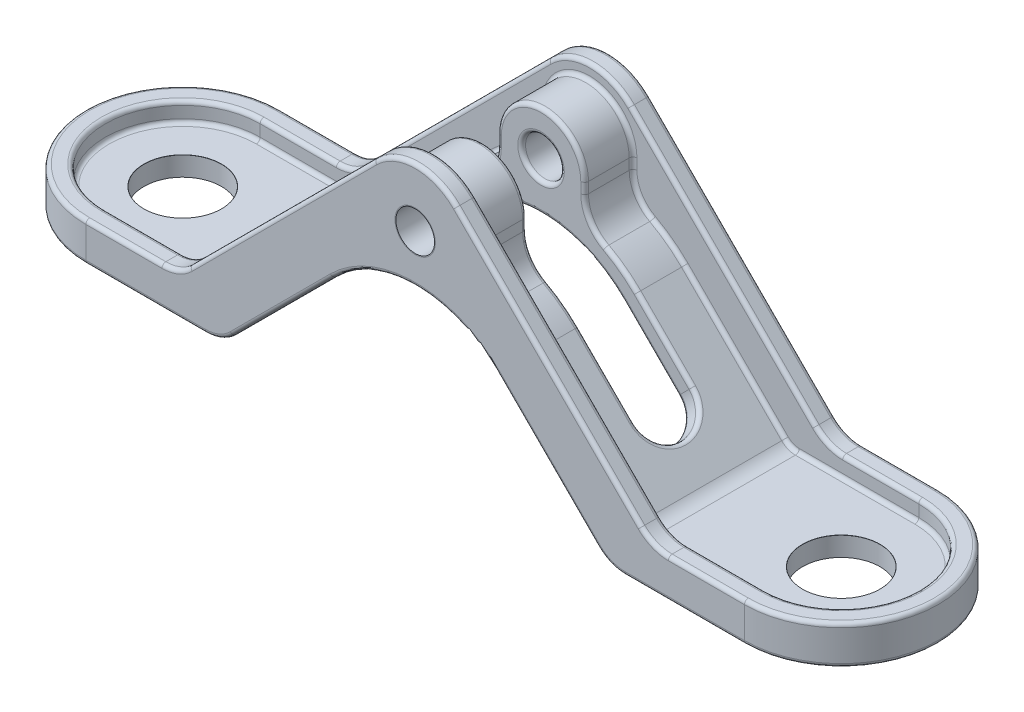
from build123d import *

# Parameters (mm, degrees)
BOSS_EXTRUDE1_DEPTH                  = 25
FILLET1_RADIUS                       = 25
FILLET1_LENGTH                       = 10
FILLET2_RADIUS                       = 25
FILLET2_LENGTH                       = 10
FILLET3_R                            = 10
SHELL1_T                             = -5
F_20_0_20_DIAMETER_HOLE1_D           = 20
F_20_0_20_DIAMETER_HOLE1_DEPTH       = 40
F_20_0_20_DIAMETER_HOLE1_CSINK_D     = 20.05
F_20_0_20_DIAMETER_HOLE1_CSINK_ANGLE = 90
F_20_0_20_DIAMETER_HOLE1_TIP         = 6.008606190275603
CUT_EXTRUDE1_DEPTH                   = 7.5
SKETCH7_R                            = 7.5
CUT_EXTRUDE2_DEPTH                   = 7.5
BOSS_EXTRUDE3_START                  = 12.5
BOSS_EXTRUDE3_DEPTH                  = 12.5
FILLET4_R                            = 10
FILLET4_OF_MIRROR7_R                 = 10
F_10_0_10_DIAMETER_HOLE1_D           = 10
F_10_0_10_DIAMETER_HOLE1_CSINK_D     = 10.05
F_10_0_10_DIAMETER_HOLE1_CSINK_ANGLE = 90
FILLET5_R                            = 1


with BuildPart() as part:
    # Sketch1 → Boss-Extrude1 (new, symmetric)
    with BuildSketch(Plane.XY):
        with BuildLine():
            Line((-110, 0), (-50, 0))
            Line((-50, 0), (-21.213203435596576, 28.78679656440344))
            ThreePointArc((-21.213203435596576, 28.78679656440344), (1.73e-15, 37.57359312880716), (21.213203435596576, 28.78679656440344))
            Line((21.213203435596576, 28.78679656440344), (50, 0))
            Line((50, 0), (110, 0))
            Line((110, 0), (110, 10.000000000000002))
            Line((110, 10.000000000000002), (61.21320343559642, 9.999999999999995))
            Line((61.21320343559642, 9.999999999999995), (10.606601717798283, 60.60660171779809))
            ThreePointArc((10.606601717798283, 60.60660171779809), (6e-16, 64.99999999999996), (-10.60660171779829, 60.60660171779809))
            Line((-10.60660171779829, 60.60660171779809), (-61.21320343559636, 9.999999999999977))
            Line((-61.21320343559636, 9.999999999999977), (-110, 10.000000000000002))
            Line((-110, 10.000000000000002), (-110, 0))
        make_face()
    extrude(amount=BOSS_EXTRUDE1_DEPTH, both=True)

    # Fillet1: full round fillet: the end face becomes a half cylinder, R = half its width
    fillet1_face = Plane((110, 5, 0), x_dir=(0, 1, 0), z_dir=(1, 0, 0))  # on the end face: x along it, z out of the body
    fillet1_slab = fillet1_face.offset(-FILLET1_RADIUS / 2) * Box(FILLET1_LENGTH, 2 * FILLET1_RADIUS, FILLET1_RADIUS, mode=Mode.PRIVATE)  # the body's end, R deep
    fillet1_round = Plane((85, 5, 0), x_dir=(1, 0, 0), z_dir=(0, 1, 0)) * Cylinder(FILLET1_RADIUS, FILLET1_LENGTH, mode=Mode.PRIVATE)  # its axis R under the face
    add(fillet1_slab - fillet1_round, mode=Mode.SUBTRACT)

    # Fillet2: full round fillet: the end face becomes a half cylinder, R = half its width
    fillet2_face = Plane((-110, 5, 0), x_dir=(0, -1, 0), z_dir=(-1, 0, 0))  # on the end face: x along it, z out of the body
    fillet2_slab = fillet2_face.offset(-FILLET2_RADIUS / 2) * Box(FILLET2_LENGTH, 2 * FILLET2_RADIUS, FILLET2_RADIUS, mode=Mode.PRIVATE)  # the body's end, R deep
    fillet2_round = Plane((-85, 5, 0), x_dir=(-1, 0, 0), z_dir=(0, -1, 0)) * Cylinder(FILLET2_RADIUS, FILLET2_LENGTH, mode=Mode.PRIVATE)  # its axis R under the face
    add(fillet2_slab - fillet2_round, mode=Mode.SUBTRACT)

    # Fillet3
    fillet3_edges = [part.edges().sort_by_distance(p)[0] for p in [
        (-61.21320343559636, 9.999999999999977, 0),
        (61.21320343559642, 9.999999999999995, 0),
        (50, 0, 0),
        (-50, 0, 0),
    ]]
    fillet(fillet3_edges, radius=FILLET3_R)

    # Shell1
    shell1_openings = [part.faces().sort_by_distance(p)[0] for p in [
        (-85.391474855, 10, 0),
        (-34.445436483, 36.767766953, 0),
        (0, 65, 0),
        (34.445436483, 36.767766953, 0),
        (85.391474855, 10, 0),
        (-61.528504736, 10.761204675, 0),
        (61.528504736, 10.761204675, 0),
    ]]
    offset(amount=SHELL1_T, openings=shell1_openings, kind=Kind.INTERSECTION)

    # Ø20.0 (20) Diameter Hole1
    with Locations(Plane(origin=(0, 5, 0), x_dir=(1, 0, 0), z_dir=(0, 1, 0))):
        with Locations((-85, 0), (85, 0)):
            CounterSinkHole(F_20_0_20_DIAMETER_HOLE1_D / 2, F_20_0_20_DIAMETER_HOLE1_CSINK_D / 2, depth=F_20_0_20_DIAMETER_HOLE1_DEPTH, counter_sink_angle=F_20_0_20_DIAMETER_HOLE1_CSINK_ANGLE)
            with Locations((0, 0, -(F_20_0_20_DIAMETER_HOLE1_DEPTH + F_20_0_20_DIAMETER_HOLE1_TIP / 2))):  # 118° drill point
                Cone(0, F_20_0_20_DIAMETER_HOLE1_D / 2, F_20_0_20_DIAMETER_HOLE1_TIP, mode=Mode.SUBTRACT)

    # Sketch6 → Cut-Extrude1 (cut, symmetric)
    with BuildSketch(Plane.XY):
        with BuildLine():
            Line((-6.94e-15, 57.0710678118655), (38.890872965260115, 18.18019484660538))
            Line((38.890872965260115, 18.18019484660538), (35.35533905932738, 14.644660940672635))
            Line((35.35533905932738, 14.644660940672635), (21.213203435596572, 28.786796564403442))
            ThreePointArc((21.213203435596572, 28.786796564403442), (1.73e-15, 37.57359312880716), (-21.213203435596576, 28.78679656440344))
            Line((-21.213203435596576, 28.78679656440344), (-35.35533905932736, 14.644660940672651))
            Line((-35.35533905932736, 14.644660940672651), (-38.890872965260094, 18.18019484660539))
            Line((-38.890872965260094, 18.18019484660539), (-6.94e-15, 57.0710678118655))
        make_face()
    extrude(amount=CUT_EXTRUDE1_DEPTH, both=True, mode=Mode.SUBTRACT)

    # Sketch7 → Cut-Extrude2 (cut, symmetric)
    with BuildSketch(Plane(origin=(-28.53553390593275, 28.535533905932734, 0), x_dir=(0, 0, 1), z_dir=(-0.7071067811865477, 0.7071067811865474, 0))):
        with Locations((0, -14.64466094067258)):
            Circle(SKETCH7_R)
    cut_extrude2 = extrude(amount=CUT_EXTRUDE2_DEPTH, both=True, mode=Mode.SUBTRACT)

    # Mirror1: Cut-Extrude2 across plane
    add(cut_extrude2.mirror(Plane(origin=(0, 0, 0), x_dir=(0, 0, 1), z_dir=(1, 0, 0))), mode=Mode.SUBTRACT)

    # Sketch8 → Boss-Extrude3 (add)
    with BuildSketch(Plane.XY.offset(-20).offset(BOSS_EXTRUDE3_START)):
        with BuildLine():
            Line((-11.250000000000002, 49.999999999999964), (-11.250000000000002, 35.3843374554159))
            ThreePointArc((-11.250000000000002, 35.3843374554159), (1.73e-15, 37.57359312880717), (11.25, 35.3843374554159))
            Line((11.25, 35.3843374554159), (11.249999999999998, 49.999999999999964))
            ThreePointArc((11.249999999999998, 49.999999999999964), (3.7e-16, 61.249999999999964), (-11.250000000000002, 49.999999999999964))
        make_face()
    boss_extrude3 = extrude(amount=-BOSS_EXTRUDE3_DEPTH)

    # Fillet4
    fillet4_edges = [part.edges().sort_by_distance(p)[0] for p in [
        (-11.250000000000002, 40.71627708771429, -13.75),
        (11.249999999999998, 40.71627708771429, -13.75),
    ]]
    fillet(fillet4_edges, radius=FILLET4_R)

    # Mirror7: Boss-Extrude3 across plane
    add(boss_extrude3.mirror(Plane.XY))

    # Fillet4 of Mirror7
    fillet4_of_mirror7_edges = [part.edges().sort_by_distance(p)[0] for p in [
        (-11.250000000000002, 40.71627708771429, 13.75),
        (11.249999999999998, 40.71627708771429, 13.75),
    ]]
    fillet(fillet4_of_mirror7_edges, radius=FILLET4_OF_MIRROR7_R)

    # Ø10.0 (10) Diameter Hole1 (through all)
    with Locations(Plane(origin=(0, 50, 25), x_dir=(1, 0, 0), z_dir=(0, 0, 1))):
        with Locations((0, 0)):
            CounterSinkHole(F_10_0_10_DIAMETER_HOLE1_D / 2, F_10_0_10_DIAMETER_HOLE1_CSINK_D / 2, counter_sink_angle=F_10_0_10_DIAMETER_HOLE1_CSINK_ANGLE)

    # Fillet5
    # the kernel refuses this fillet: 1 mm, written as the material it adds along each edge
    with BuildSketch(Plane(origin=(-1.78e-15, 49.999999999999964, -20), x_dir=(1, 0, 0), z_dir=(0, -1, 0))) as fillet5_piece_1:
        with BuildLine():
            CenterArc((11.25 + FILLET5_R, FILLET5_R), FILLET5_R, 180, 90)
            Line((11.25, FILLET5_R), (11.25, 0))
            Line((11.25, 0), (11.25 + FILLET5_R, 0))
        make_face()
    revolve(axis=Axis((-1.78e-15, 49.999999999999964, -20), (0, 0, 1)), revolution_arc=180)
    with BuildSketch(Plane(origin=(-11.250000000000002, 49.999999999999964, -20), x_dir=(-1, 0, 0), z_dir=(0, -1, 0))) as fillet5_piece_2:
        with BuildLine():
            CenterArc((FILLET5_R, -FILLET5_R), FILLET5_R, 90, 90)
            Line((0, -FILLET5_R), (0, 0))
            Line((0, 0), (FILLET5_R, 0))
        make_face()
    extrude(amount=2.7598277396367195)
    with BuildSketch(Plane(origin=(11.249999999999998, 47.24017226036324, -20), x_dir=(1, 1.2e-16, 0), z_dir=(-1.2e-16, 1, 0))) as fillet5_piece_3:
        with BuildLine():
            CenterArc((FILLET5_R, -FILLET5_R), FILLET5_R, 90, 90)
            Line((0, -FILLET5_R), (0, 0))
            Line((0, 0), (FILLET5_R, 0))
        make_face()
    extrude(amount=2.7598277396367266)
    with BuildSketch(Plane(origin=(0, 7.573593128807143, -20), x_dir=(0.7071067811865523, 0.7071067811865427, 0), z_dir=(0.7071067811865427, -0.7071067811865523, 0))) as fillet5_piece_4:
        with BuildLine():
            CenterArc((35.00000000000002 + FILLET5_R, FILLET5_R), FILLET5_R, 180, 90)
            Line((35.00000000000002, FILLET5_R), (35.00000000000002, 0))
            Line((35.00000000000002, 0), (35.00000000000002 + FILLET5_R, 0))
        make_face()
    revolve(axis=Axis((0, 7.573593128807143, -20), (0, 0, 1)), revolution_arc=16.821357259470535)
    with BuildSketch(Plane(origin=(21.25, 47.24017226036324, -20), x_dir=(-1, 0, 0), z_dir=(0, 1, 0))) as fillet5_piece_5:
        with BuildLine():
            CenterArc((10.000000000000002 - FILLET5_R, FILLET5_R), FILLET5_R, 270, 90)
            Line((10.000000000000002, FILLET5_R), (10.000000000000002, 0))
            Line((10.000000000000002, 0), (10.000000000000002 - FILLET5_R, 0))
        make_face()
    revolve(axis=Axis((21.25, 47.24017226036324, -20), (0, 0, 1)), revolution_arc=61.821357259470126)
    with BuildSketch(Plane(origin=(-21.25, 47.24017226036324, -20), x_dir=(0.47222222222222143, -0.881479536256802, 0), z_dir=(-0.881479536256802, -0.47222222222222143, 0))) as fillet5_piece_6:
        with BuildLine():
            CenterArc((9.999999999999998 - FILLET5_R, FILLET5_R), FILLET5_R, 270, 90)
            Line((9.999999999999998, FILLET5_R), (9.999999999999998, 0))
            Line((9.999999999999998, 0), (9.999999999999998 - FILLET5_R, 0))
        make_face()
    revolve(axis=Axis((-21.25, 47.24017226036324, -20), (0, 0, 1)), revolution_arc=61.82135725947022)
    with BuildSketch(Plane(origin=(-1.78e-15, 49.999999999999964, 20), x_dir=(1, 0, 0), z_dir=(0, -1, 0))) as fillet5_piece_7:
        with BuildLine():
            CenterArc((11.25 + FILLET5_R, -FILLET5_R), FILLET5_R, 90, 90)
            Line((11.25, -FILLET5_R), (11.25, 0))
            Line((11.25, 0), (11.25 + FILLET5_R, 0))
        make_face()
    revolve(axis=Axis((-1.78e-15, 49.999999999999964, 20), (0, 0, 1)), revolution_arc=180)
    with BuildSketch(Plane(origin=(-11.250000000000002, 49.999999999999964, 20), x_dir=(-1, 0, 0), z_dir=(0, -1, 0))) as fillet5_piece_8:
        with BuildLine():
            CenterArc((FILLET5_R, FILLET5_R), FILLET5_R, 180, 90)
            Line((0, FILLET5_R), (0, 0))
            Line((0, 0), (FILLET5_R, 0))
        make_face()
    extrude(amount=2.7598277396367195)
    with BuildSketch(Plane(origin=(11.249999999999998, 47.24017226036324, 20), x_dir=(1, 1.2e-16, 0), z_dir=(-1.2e-16, 1, 0))) as fillet5_piece_9:
        with BuildLine():
            CenterArc((FILLET5_R, FILLET5_R), FILLET5_R, 180, 90)
            Line((0, FILLET5_R), (0, 0))
            Line((0, 0), (FILLET5_R, 0))
        make_face()
    extrude(amount=2.7598277396367266)
    with BuildSketch(Plane(origin=(0, 7.573593128807143, 20), x_dir=(0.7071067811865523, 0.7071067811865427, 0), z_dir=(0.7071067811865427, -0.7071067811865523, 0))) as fillet5_piece_10:
        with BuildLine():
            CenterArc((35.00000000000002 + FILLET5_R, -FILLET5_R), FILLET5_R, 90, 90)
            Line((35.00000000000002, -FILLET5_R), (35.00000000000002, 0))
            Line((35.00000000000002, 0), (35.00000000000002 + FILLET5_R, 0))
        make_face()
    revolve(axis=Axis((0, 7.573593128807143, 20), (0, 0, 1)), revolution_arc=16.821357259470535)
    with BuildSketch(Plane(origin=(21.25, 47.24017226036324, 20), x_dir=(-1, 0, 0), z_dir=(0, 1, 0))) as fillet5_piece_11:
        with BuildLine():
            CenterArc((10.000000000000002 - FILLET5_R, -FILLET5_R), FILLET5_R, 0, 90)
            Line((10.000000000000002, -FILLET5_R), (10.000000000000002, 0))
            Line((10.000000000000002, 0), (10.000000000000002 - FILLET5_R, 0))
        make_face()
    revolve(axis=Axis((21.25, 47.24017226036324, 20), (0, 0, 1)), revolution_arc=61.821357259470126)
    with BuildSketch(Plane(origin=(-21.25, 47.24017226036324, 20), x_dir=(0.47222222222222143, -0.881479536256802, 0), z_dir=(-0.881479536256802, -0.47222222222222143, 0))) as fillet5_piece_12:
        with BuildLine():
            CenterArc((9.999999999999998 - FILLET5_R, -FILLET5_R), FILLET5_R, 0, 90)
            Line((9.999999999999998, -FILLET5_R), (9.999999999999998, 0))
            Line((9.999999999999998, 0), (9.999999999999998 - FILLET5_R, 0))
        make_face()
    revolve(axis=Axis((-21.25, 47.24017226036324, 20), (0, 0, 1)), revolution_arc=61.82135725947022)
    with BuildSketch(Plane(origin=(-85, 5, -20), x_dir=(0, 1, 0), z_dir=(1, 0, 0)), Plane(origin=(54.14213562373095, 5, -20), x_dir=(0, 1, 0), z_dir=(1, 0, 0))) as fillet5_piece_13:
        with BuildLine():
            CenterArc((FILLET5_R, FILLET5_R), FILLET5_R, 180, 90)
            Line((0, FILLET5_R), (0, 0))
            Line((0, 0), (FILLET5_R, 0))
        make_face()
    extrude(amount=30.85786437626905)
    with BuildSketch(Plane(origin=(-85, 5, 0), x_dir=(0, 0, 1), z_dir=(1, 0, 0))) as fillet5_piece_14:
        with BuildLine():
            CenterArc((20 - FILLET5_R, -FILLET5_R), FILLET5_R, 0, 90)
            Line((20 - FILLET5_R, 0), (20, 0))
            Line((20, 0), (20, -FILLET5_R))
        make_face()
    revolve(axis=Axis((-85, 5, 0), (0, -1, 0)), revolution_arc=180)
    with BuildSketch(Plane(origin=(-50.60660171779821, 6.464466094067262, -20), x_dir=(-0.7071067811865478, 0.7071067811865474, 0), z_dir=(0.7071067811865474, 0.7071067811865477, 0))) as fillet5_piece_15:
        with BuildLine():
            CenterArc((FILLET5_R, FILLET5_R), FILLET5_R, 180, 90)
            Line((-2.51e-15, FILLET5_R), (0, 0))
            Line((0, 0), (FILLET5_R, 0))
        make_face()
    extrude(amount=36.5685424949236)
    with BuildSketch(Plane(origin=(0, 7.573593128807143, -20), x_dir=(-0.4722222222222224, 0.8814795362568015, 0), z_dir=(0.8814795362568015, 0.4722222222222224, 0))) as fillet5_piece_16:
        with BuildLine():
            CenterArc((35.00000000000002 + FILLET5_R, FILLET5_R), FILLET5_R, 180, 90)
            Line((35.00000000000002, FILLET5_R), (35.00000000000002, 0))
            Line((35.00000000000002, 0), (35.00000000000002 + FILLET5_R, 0))
        make_face()
    revolve(axis=Axis((0, 7.573593128807143, -20), (0, 0, 1)), revolution_arc=16.821357259470485)
    with BuildSketch(Plane(origin=(24.748737341529317, 32.322330470336176, -20), x_dir=(0.7071067811865478, 0.7071067811865474, 0), z_dir=(0.7071067811865474, -0.7071067811865477, 0))) as fillet5_piece_17:
        with BuildLine():
            CenterArc((FILLET5_R, FILLET5_R), FILLET5_R, 180, 90)
            Line((0, FILLET5_R), (0, 0))
            Line((0, 0), (FILLET5_R, 0))
        make_face()
    extrude(amount=36.5685424949236)
    with BuildSketch(Plane(origin=(85, 5, 0), x_dir=(0, 0, 1), z_dir=(-1, 0, 0))) as fillet5_piece_18:
        with BuildLine():
            CenterArc((20 - FILLET5_R, FILLET5_R), FILLET5_R, 270, 90)
            Line((20 - FILLET5_R, 0), (20, 0))
            Line((20, 0), (20, FILLET5_R))
        make_face()
    revolve(axis=Axis((85, 5, 0), (0, 1, 0)), revolution_arc=180)
    with BuildSketch(Plane(origin=(24.748737341529317, 32.322330470336176, 20), x_dir=(0.7071067811865478, 0.7071067811865474, 0), z_dir=(0.7071067811865474, -0.7071067811865477, 0))) as fillet5_piece_19:
        with BuildLine():
            CenterArc((FILLET5_R, -FILLET5_R), FILLET5_R, 90, 90)
            Line((0, -FILLET5_R), (0, 0))
            Line((0, 0), (FILLET5_R, 0))
        make_face()
    extrude(amount=36.5685424949236)
    with BuildSketch(Plane(origin=(54.14213562373095, 10, 20), x_dir=(-0.7071067811865476, -0.7071067811865474, 0), z_dir=(-0.7071067811865474, 0.7071067811865476, 0))) as fillet5_piece_20:
        with BuildLine():
            CenterArc((4.999999999999998 - FILLET5_R, -FILLET5_R), FILLET5_R, 0, 90)
            Line((4.999999999999998, -FILLET5_R), (4.999999999999998, 0))
            Line((4.999999999999998, 0), (4.999999999999998 - FILLET5_R, 0))
        make_face()
    revolve(axis=Axis((54.14213562373095, 10, 20), (0, 0, 1)), revolution_arc=45)
    with BuildSketch(Plane(origin=(54.14213562373095, 5, 20), x_dir=(0, 1, 0), z_dir=(1, 0, 0)), Plane(origin=(-85, 5, 20), x_dir=(0, 1, 0), z_dir=(1, 0, 0))) as fillet5_piece_21:
        with BuildLine():
            CenterArc((FILLET5_R, -FILLET5_R), FILLET5_R, 90, 90)
            Line((0, -FILLET5_R), (0, 0))
            Line((0, 0), (FILLET5_R, 0))
        make_face()
    extrude(amount=30.85786437626905)
    with BuildSketch(Plane(origin=(-54.14213562373095, 10, 20), x_dir=(0, -1, 0), z_dir=(-1, 0, 0))) as fillet5_piece_22:
        with BuildLine():
            CenterArc((5 - FILLET5_R, -FILLET5_R), FILLET5_R, 0, 90)
            Line((5, -FILLET5_R), (5, 0))
            Line((5, 0), (5 - FILLET5_R, 0))
        make_face()
    revolve(axis=Axis((-54.14213562373095, 10, 20), (0, 0, 1)), revolution_arc=45)
    with BuildSketch(Plane(origin=(-50.60660171779821, 6.464466094067262, 20), x_dir=(-0.7071067811865478, 0.7071067811865474, 0), z_dir=(0.7071067811865474, 0.7071067811865477, 0))) as fillet5_piece_23:
        with BuildLine():
            CenterArc((FILLET5_R, -FILLET5_R), FILLET5_R, 90, 90)
            Line((-2.51e-15, -FILLET5_R), (0, 0))
            Line((0, 0), (FILLET5_R, 0))
        make_face()
    extrude(amount=36.5685424949236)
    with BuildSketch(Plane(origin=(0, 7.573593128807143, 20), x_dir=(-0.4722222222222224, 0.8814795362568015, 0), z_dir=(0.8814795362568015, 0.4722222222222224, 0))) as fillet5_piece_24:
        with BuildLine():
            CenterArc((35.00000000000002 + FILLET5_R, -FILLET5_R), FILLET5_R, 90, 90)
            Line((35.00000000000002, -FILLET5_R), (35.00000000000002, 0))
            Line((35.00000000000002, 0), (35.00000000000002 + FILLET5_R, 0))
        make_face()
    revolve(axis=Axis((0, 7.573593128807143, 20), (0, 0, 1)), revolution_arc=16.821357259470485)
    with BuildSketch(Plane(origin=(54.14213562373095, 10, -20), x_dir=(-0.7071067811865476, -0.7071067811865474, 0), z_dir=(-0.7071067811865474, 0.7071067811865476, 0))) as fillet5_piece_25:
        with BuildLine():
            CenterArc((4.999999999999998 - FILLET5_R, FILLET5_R), FILLET5_R, 270, 90)
            Line((4.999999999999998, FILLET5_R), (4.999999999999998, 0))
            Line((4.999999999999998, 0), (4.999999999999998 - FILLET5_R, 0))
        make_face()
    revolve(axis=Axis((54.14213562373095, 10, -20), (0, 0, 1)), revolution_arc=45)
    with BuildSketch(Plane(origin=(-54.14213562373095, 10, -20), x_dir=(0, -1, 0), z_dir=(-1, 0, 0))) as fillet5_piece_26:
        with BuildLine():
            CenterArc((5 - FILLET5_R, FILLET5_R), FILLET5_R, 270, 90)
            Line((5, FILLET5_R), (5, 0))
            Line((5, 0), (5 - FILLET5_R, 0))
        make_face()
    revolve(axis=Axis((-54.14213562373095, 10, -20), (0, 0, 1)), revolution_arc=45)
    # the kernel refuses this fillet: 1 mm, written as the material it takes off along each edge
    with BuildSketch(Plane(origin=(-10.606601717798291, 60.60660171779809, -25), x_dir=(0.7071067811865478, -0.7071067811865474, 0), z_dir=(-0.7071067811865472, -0.7071067811865478, 0))) as fillet5_2_piece_1:
        with BuildLine():
            CenterArc((FILLET5_R, FILLET5_R), FILLET5_R, 180, 90)
            Line((0, FILLET5_R), (0, 0))
            Line((0, 0), (FILLET5_R, 0))
        make_face()
    extrude(amount=67.42640687119268, mode=Mode.SUBTRACT)
    with BuildSketch(Plane(origin=(-3.11e-15, 49.99999999999996, -25), x_dir=(0.7071067811865526, 0.7071067811865425, 0), z_dir=(0.7071067811865425, -0.7071067811865526, 0))) as fillet5_2_piece_2:
        with BuildLine():
            CenterArc((14.999999999999998 - FILLET5_R, FILLET5_R), FILLET5_R, 270, 90)
            Line((15, FILLET5_R), (14.999999999999998, 0))
            Line((14.999999999999998, 0), (14.999999999999998 - FILLET5_R, 0))
        make_face()
    revolve(axis=Axis((-3.11e-15, 49.99999999999996, -25), (0, 0, 1)), revolution_arc=90.00000000000082, mode=Mode.SUBTRACT)
    with BuildSketch(Plane(origin=(24.74873734152934, 32.322330470336155, -7.5), x_dir=(-3.55e-15, -3.55e-15, -1), z_dir=(0.7071067811865476, -0.7071067811865475, 0))) as fillet5_2_piece_3:
        with BuildLine():
            CenterArc((FILLET5_R, -FILLET5_R), FILLET5_R, 90.0000000000003, 89.99999999999956)
            Line((5.02e-15, -FILLET5_R), (0, 0))
            Line((0, 0), (FILLET5_R, 0))
        make_face()
    extrude(amount=19.99999999999975, mode=Mode.SUBTRACT)
    with BuildSketch(Plane(origin=(0, 7.573593128807143, 7.5), x_dir=(-0.4722222222222224, 0.8814795362568015, 0), z_dir=(0.8814795362568015, 0.4722222222222224, 0))) as fillet5_2_piece_4:
        with BuildLine():
            CenterArc((35.00000000000002 - FILLET5_R, FILLET5_R), FILLET5_R, 270, 90)
            Line((35.00000000000002 - FILLET5_R, 0), (35.00000000000002, 0))
            Line((35.00000000000002, 0), (35.00000000000002, FILLET5_R))
        make_face()
    revolve(axis=Axis((0, 7.573593128807143, 7.5), (0, 0, 1)), revolution_arc=16.821357259470485, mode=Mode.SUBTRACT)
    with BuildSketch(Plane(origin=(35.35533905932738, 14.644660940672635, -7.5), x_dir=(0.7071067811865477, 0.7071067811865475, 0), z_dir=(-0.7071067811865475, 0.7071067811865476, 0))) as fillet5_2_piece_5:
        with BuildLine():
            CenterArc((FILLET5_R, FILLET5_R), FILLET5_R, 180, 90)
            Line((0, FILLET5_R), (0, 0))
            Line((0, 0), (FILLET5_R, 0))
        make_face()
    extrude(amount=19.999999999999797, mode=Mode.SUBTRACT)
    with BuildSketch(Plane(origin=(0, 7.573593128807143, -7.5), x_dir=(0.7071067811865521, 0.7071067811865429, 0), z_dir=(0.7071067811865429, -0.7071067811865521, 0))) as fillet5_2_piece_6:
        with BuildLine():
            CenterArc((30.000000000000018 + FILLET5_R, -FILLET5_R), FILLET5_R, 90, 90)
            Line((30.000000000000018, -FILLET5_R), (30.000000000000018, 0))
            Line((30.000000000000018, 0), (30.000000000000018 + FILLET5_R, 0))
        make_face()
    revolve(axis=Axis((0, 7.573593128807143, -7.5), (0, 0, 1)), revolution_arc=90.00000000000077, mode=Mode.SUBTRACT)
    with BuildSketch(Plane(origin=(-21.213203435596576, 28.78679656440344, -7.5), x_dir=(-0.7071067811865476, 0.7071067811865476, 0), z_dir=(-0.7071067811865476, -0.7071067811865476, 0))) as fillet5_2_piece_7:
        with BuildLine():
            CenterArc((FILLET5_R, FILLET5_R), FILLET5_R, 180, 90)
            Line((-2.51e-15, FILLET5_R), (0, 0))
            Line((0, 0), (FILLET5_R, 0))
        make_face()
    extrude(amount=19.999999999999773, mode=Mode.SUBTRACT)
    with BuildSketch(Plane(origin=(21.213203435596576, 28.78679656440344, -25), x_dir=(0.7071067811865478, 0.7071067811865474, 0), z_dir=(0.7071067811865474, -0.7071067811865477, 0))) as fillet5_2_piece_8:
        with BuildLine():
            CenterArc((FILLET5_R, FILLET5_R), FILLET5_R, 180, 90)
            Line((0, FILLET5_R), (0, 0))
            Line((0, 0), (FILLET5_R, 0))
        make_face()
    extrude(amount=36.5685424949236, mode=Mode.SUBTRACT)
    with BuildSketch(Plane(origin=(-38.890872965260094, 18.18019484660539, -7.5), x_dir=(3.55e-15, -3.55e-15, -1), z_dir=(0.7071067811865474, 0.7071067811865477, 0))) as fillet5_2_piece_9:
        with BuildLine():
            CenterArc((FILLET5_R, -FILLET5_R), FILLET5_R, 90.0000000000003, 89.9999999999997)
            Line((5.02e-15, -FILLET5_R), (0, 0))
            Line((0, 0), (FILLET5_R, 0))
        make_face()
    extrude(amount=19.99999999999973, mode=Mode.SUBTRACT)
    with BuildSketch(Plane(origin=(0, 7.573593128807143, -7.5), x_dir=(-0.4722222222222224, 0.8814795362568015, 0), z_dir=(0.8814795362568015, 0.4722222222222224, 0))) as fillet5_2_piece_10:
        with BuildLine():
            CenterArc((35.00000000000002 - FILLET5_R, -FILLET5_R), FILLET5_R, 0, 90)
            Line((35.00000000000002, -FILLET5_R), (35.00000000000002, 0))
            Line((35.00000000000002, 0), (35.00000000000002 - FILLET5_R, 0))
        make_face()
    revolve(axis=Axis((0, 7.573593128807143, -7.5), (0, 0, 1)), revolution_arc=16.821357259470485, mode=Mode.SUBTRACT)
    with BuildSketch(Plane(origin=(-38.890872965260094, 18.18019484660539, 7.5), x_dir=(3.55e-15, -3.55e-15, 1), z_dir=(0.7071067811865474, 0.7071067811865477, 0))) as fillet5_2_piece_11:
        with BuildLine():
            CenterArc((FILLET5_R, FILLET5_R), FILLET5_R, 180, 89.99999999999972)
            Line((5.02e-15, FILLET5_R), (0, 0))
            Line((0, 0), (FILLET5_R, 0))
        make_face()
    extrude(amount=19.99999999999973, mode=Mode.SUBTRACT)
    with BuildSketch(Plane(origin=(-21.213203435596576, 28.78679656440344, 7.5), x_dir=(-0.7071067811865476, 0.7071067811865476, 0), z_dir=(-0.7071067811865476, -0.7071067811865476, 0))) as fillet5_2_piece_12:
        with BuildLine():
            CenterArc((FILLET5_R, -FILLET5_R), FILLET5_R, 90, 90)
            Line((-2.51e-15, -FILLET5_R), (0, 0))
            Line((0, 0), (FILLET5_R, 0))
        make_face()
    extrude(amount=19.999999999999773, mode=Mode.SUBTRACT)
    with BuildSketch(Plane(origin=(0, 7.573593128807143, 7.5), x_dir=(0.7071067811865521, 0.7071067811865429, 0), z_dir=(0.7071067811865429, -0.7071067811865521, 0))) as fillet5_2_piece_13:
        with BuildLine():
            CenterArc((30.000000000000018 + FILLET5_R, FILLET5_R), FILLET5_R, 180, 90)
            Line((30.000000000000018, FILLET5_R), (30.000000000000018, 0))
            Line((30.000000000000018, 0), (30.000000000000018 + FILLET5_R, 0))
        make_face()
    revolve(axis=Axis((0, 7.573593128807143, 7.5), (0, 0, 1)), revolution_arc=90.00000000000077, mode=Mode.SUBTRACT)
    with BuildSketch(Plane(origin=(35.35533905932738, 14.644660940672635, 7.5), x_dir=(0.7071067811865477, 0.7071067811865475, 0), z_dir=(-0.7071067811865475, 0.7071067811865476, 0))) as fillet5_2_piece_14:
        with BuildLine():
            CenterArc((FILLET5_R, -FILLET5_R), FILLET5_R, 90, 90)
            Line((0, -FILLET5_R), (0, 0))
            Line((0, 0), (FILLET5_R, 0))
        make_face()
    extrude(amount=19.999999999999797, mode=Mode.SUBTRACT)
    with BuildSketch(Plane(origin=(24.74873734152934, 32.322330470336155, 7.5), x_dir=(-3.55e-15, -3.55e-15, 1), z_dir=(0.7071067811865476, -0.7071067811865475, 0))) as fillet5_2_piece_15:
        with BuildLine():
            CenterArc((FILLET5_R, FILLET5_R), FILLET5_R, 180.00000000000014, 89.99999999999955)
            Line((5.02e-15, FILLET5_R), (0, 0))
            Line((0, 0), (FILLET5_R, 0))
        make_face()
    extrude(amount=19.99999999999975, mode=Mode.SUBTRACT)
    with BuildSketch(Plane(origin=(0, 7.573593128807143, -25), x_dir=(-0.7071067811865522, 0.7071067811865428, 0), z_dir=(-0.7071067811865428, -0.7071067811865522, 0))) as fillet5_2_piece_16:
        with BuildLine():
            CenterArc((30.000000000000014 + FILLET5_R, -FILLET5_R), FILLET5_R, 90, 90)
            Line((30.000000000000014, -FILLET5_R), (30.000000000000014, 0))
            Line((30.000000000000014, 0), (30.000000000000014 + FILLET5_R, 0))
        make_face()
    revolve(axis=Axis((0, 7.573593128807143, -25), (0, 0, -1)), revolution_arc=90.00000000000077, mode=Mode.SUBTRACT)
    with BuildSketch(Plane(origin=(0, 7.573593128807143, 25), x_dir=(-0.7071067811865522, 0.7071067811865428, 0), z_dir=(-0.7071067811865428, -0.7071067811865522, 0))) as fillet5_2_piece_17:
        with BuildLine():
            CenterArc((30.000000000000014 + FILLET5_R, FILLET5_R), FILLET5_R, 180, 90)
            Line((30.000000000000014, FILLET5_R), (30.000000000000014, 0))
            Line((30.000000000000014, 0), (30.000000000000014 + FILLET5_R, 0))
        make_face()
    revolve(axis=Axis((0, 7.573593128807143, 25), (0, 0, -1)), revolution_arc=90.00000000000077, mode=Mode.SUBTRACT)
    with BuildSketch(Plane(origin=(-38.890872965260094, 18.180194846605392, 0), x_dir=(0, 0, -1), z_dir=(0.7071067811865474, 0.7071067811865477, 0))) as fillet5_2_piece_18:
        with BuildLine():
            CenterArc((7.5 + FILLET5_R, -FILLET5_R), FILLET5_R, 90.0000000000001, 89.99999999999976)
            Line((7.5, -FILLET5_R), (7.5, 2.51e-15))
            Line((7.5, 2.51e-15), (7.5 + FILLET5_R, 0))
        make_face()
    revolve(axis=Axis((-38.890872965260094, 18.180194846605392, 0), (-0.7071067811865477, 0.7071067811865474, 0)), revolution_arc=180, mode=Mode.SUBTRACT)
    with BuildSketch(Plane(origin=(-35.355339059327356, 14.644660940672658, 0), x_dir=(0, 0, -1), z_dir=(0.7071067811865474, 0.7071067811865477, 0))) as fillet5_2_piece_19:
        with BuildLine():
            CenterArc((7.5 + FILLET5_R, FILLET5_R), FILLET5_R, 180, 90)
            Line((7.5 + FILLET5_R, 2.51e-15), (7.5, 1.26e-15))
            Line((7.5, 1.26e-15), (7.499999999999998, FILLET5_R))
        make_face()
    revolve(axis=Axis((-35.355339059327356, 14.644660940672658, 0), (-0.7071067811865477, 0.7071067811865474, 0)), revolution_arc=180, mode=Mode.SUBTRACT)
    with BuildSketch(Plane(origin=(38.890872965260094, 18.180194846605392, 0), x_dir=(0, 0, 1), z_dir=(-0.7071067811865474, 0.7071067811865477, 0))) as fillet5_2_piece_20:
        with BuildLine():
            CenterArc((7.5 + FILLET5_R, -FILLET5_R), FILLET5_R, 90.0000000000001, 89.9999999999999)
            Line((7.5, -FILLET5_R), (7.5, 0))
            Line((7.5, 0), (7.5 + FILLET5_R, 0))
        make_face()
    revolve(axis=Axis((38.890872965260094, 18.180194846605392, 0), (0.7071067811865477, 0.7071067811865474, 0)), revolution_arc=180, mode=Mode.SUBTRACT)
    with BuildSketch(Plane(origin=(35.355339059327356, 14.644660940672658, 0), x_dir=(0, 0, 1), z_dir=(-0.7071067811865474, 0.7071067811865477, 0))) as fillet5_2_piece_21:
        with BuildLine():
            CenterArc((7.5 + FILLET5_R, FILLET5_R), FILLET5_R, 180, 90)
            Line((7.499999999999998, FILLET5_R), (7.5, 1.26e-15))
            Line((7.5, 1.26e-15), (7.5 + FILLET5_R, 0))
        make_face()
    revolve(axis=Axis((35.355339059327356, 14.644660940672658, 0), (0.7071067811865477, 0.7071067811865474, 0)), revolution_arc=180, mode=Mode.SUBTRACT)
    with BuildSketch(Plane(origin=(-11.250000000000002, 49.999999999999964, -7.5), x_dir=(1, 0, 0), z_dir=(0, -1, 0)), Plane(origin=(-11.250000000000002, 49.999999999999964, 7.5), x_dir=(0, 0, 1), z_dir=(0, -1, 0))) as fillet5_2_piece_22:
        with BuildLine():
            CenterArc((FILLET5_R, -FILLET5_R), FILLET5_R, 90, 90)
            Line((0, -FILLET5_R), (0, 0))
            Line((0, 0), (FILLET5_R, 0))
        make_face()
    extrude(amount=2.7598277396367195, mode=Mode.SUBTRACT)
    with BuildSketch(Plane(origin=(-1.78e-15, 49.999999999999964, -7.5), x_dir=(1, 0, 0), z_dir=(0, -1, 0))) as fillet5_2_piece_23:
        with BuildLine():
            CenterArc((11.25 - FILLET5_R, -FILLET5_R), FILLET5_R, 0, 90)
            Line((11.25, -FILLET5_R), (11.25, 0))
            Line((11.25, 0), (11.25 - FILLET5_R, 0))
        make_face()
    revolve(axis=Axis((-1.78e-15, 49.999999999999964, -7.5), (0, 0, 1)), revolution_arc=180, mode=Mode.SUBTRACT)
    with BuildSketch(Plane(origin=(0, 7.573593128807143, -7.5), x_dir=(0.7071067811865523, 0.7071067811865427, 0), z_dir=(0.7071067811865427, -0.7071067811865523, 0))) as fillet5_2_piece_24:
        with BuildLine():
            CenterArc((35.00000000000002 - FILLET5_R, -FILLET5_R), FILLET5_R, 0, 90)
            Line((35.00000000000002, -FILLET5_R), (35.00000000000002, 0))
            Line((35.00000000000002, 0), (35.00000000000002 - FILLET5_R, 0))
        make_face()
    revolve(axis=Axis((0, 7.573593128807143, -7.5), (0, 0, 1)), revolution_arc=16.821357259470535, mode=Mode.SUBTRACT)
    with BuildSketch(Plane(origin=(21.213203435596576, 28.78679656440344, 25), x_dir=(0.7071067811865478, 0.7071067811865474, 0), z_dir=(0.7071067811865474, -0.7071067811865477, 0))) as fillet5_2_piece_25:
        with BuildLine():
            CenterArc((FILLET5_R, -FILLET5_R), FILLET5_R, 90, 90)
            Line((0, -FILLET5_R), (0, 0))
            Line((0, 0), (FILLET5_R, 0))
        make_face()
    extrude(amount=36.5685424949236, mode=Mode.SUBTRACT)
    with BuildSketch(Plane(origin=(11.249999999999998, 47.24017226036324, -7.5), x_dir=(-1, -1.2e-16, 0), z_dir=(-1.2e-16, 1, 0)), Plane(origin=(11.249999999999998, 47.24017226036324, 7.5), x_dir=(0, 0, 1), z_dir=(-1.2e-16, 1, 0))) as fillet5_2_piece_26:
        with BuildLine():
            CenterArc((FILLET5_R, -FILLET5_R), FILLET5_R, 90, 90)
            Line((0, -FILLET5_R), (0, 0))
            Line((0, 0), (FILLET5_R, 0))
        make_face()
    extrude(amount=2.7598277396367266, mode=Mode.SUBTRACT)
    with BuildSketch(Plane(origin=(-21.25, 47.24017226036324, -7.5), x_dir=(0.47222222222222143, -0.881479536256802, 0), z_dir=(-0.881479536256802, -0.47222222222222143, 0))) as fillet5_2_piece_27:
        with BuildLine():
            CenterArc((9.999999999999998 + FILLET5_R, -FILLET5_R), FILLET5_R, 90, 90)
            Line((9.999999999999998, -FILLET5_R), (9.999999999999998, 0))
            Line((9.999999999999998, 0), (9.999999999999998 + FILLET5_R, 0))
        make_face()
    revolve(axis=Axis((-21.25, 47.24017226036324, -7.5), (0, 0, 1)), revolution_arc=61.82135725947022, mode=Mode.SUBTRACT)
    with BuildSketch(Plane(origin=(21.25, 47.24017226036324, -7.5), x_dir=(-1, 0, 0), z_dir=(0, 1, 0))) as fillet5_2_piece_28:
        with BuildLine():
            CenterArc((10.000000000000002 + FILLET5_R, -FILLET5_R), FILLET5_R, 90, 90)
            Line((10.000000000000002, -FILLET5_R), (10.000000000000002, 0))
            Line((10.000000000000002, 0), (10.000000000000002 + FILLET5_R, 0))
        make_face()
    revolve(axis=Axis((21.25, 47.24017226036324, -7.5), (0, 0, 1)), revolution_arc=61.821357259470126, mode=Mode.SUBTRACT)
    with BuildSketch(Plane(origin=(-1.78e-15, 49.999999999999964, 7.5), x_dir=(1, 0, 0), z_dir=(0, -1, 0))) as fillet5_2_piece_29:
        with BuildLine():
            CenterArc((11.25 - FILLET5_R, FILLET5_R), FILLET5_R, 270, 90)
            Line((11.25 - FILLET5_R, 0), (11.25, 0))
            Line((11.25, 0), (11.25, FILLET5_R))
        make_face()
    revolve(axis=Axis((-1.78e-15, 49.999999999999964, 7.5), (0, 0, 1)), revolution_arc=180, mode=Mode.SUBTRACT)
    with BuildSketch(Plane(origin=(0, 7.573593128807143, 7.5), x_dir=(0.7071067811865523, 0.7071067811865427, 0), z_dir=(0.7071067811865427, -0.7071067811865523, 0))) as fillet5_2_piece_30:
        with BuildLine():
            CenterArc((35.00000000000002 - FILLET5_R, FILLET5_R), FILLET5_R, 270, 90)
            Line((35.00000000000002 - FILLET5_R, 0), (35.00000000000002, 0))
            Line((35.00000000000002, 0), (35.00000000000002, FILLET5_R))
        make_face()
    revolve(axis=Axis((0, 7.573593128807143, 7.5), (0, 0, 1)), revolution_arc=16.821357259470535, mode=Mode.SUBTRACT)
    with BuildSketch(Plane(origin=(-21.25, 47.24017226036324, 7.5), x_dir=(0.47222222222222143, -0.881479536256802, 0), z_dir=(-0.881479536256802, -0.47222222222222143, 0))) as fillet5_2_piece_31:
        with BuildLine():
            CenterArc((9.999999999999998 + FILLET5_R, FILLET5_R), FILLET5_R, 180, 89.99999999999989)
            Line((9.999999999999998 + FILLET5_R, 0), (9.999999999999998, 0))
            Line((9.999999999999998, 0), (10, FILLET5_R))
        make_face()
    revolve(axis=Axis((-21.25, 47.24017226036324, 7.5), (0, 0, 1)), revolution_arc=61.82135725947022, mode=Mode.SUBTRACT)
    with BuildSketch(Plane(origin=(21.25, 47.24017226036324, 7.5), x_dir=(-1, 0, 0), z_dir=(0, 1, 0))) as fillet5_2_piece_32:
        with BuildLine():
            CenterArc((10.000000000000002 + FILLET5_R, FILLET5_R), FILLET5_R, 180, 90)
            Line((10.000000000000002 + FILLET5_R, 0), (10.000000000000002, 0))
            Line((10.000000000000002, 0), (10.000000000000002, FILLET5_R))
        make_face()
    revolve(axis=Axis((21.25, 47.24017226036324, 7.5), (0, 0, 1)), revolution_arc=61.821357259470126, mode=Mode.SUBTRACT)
    with BuildSketch(Plane(origin=(0, 50, -7.5), x_dir=(-1, 0, 0), z_dir=(0, -1, 0))) as fillet5_2_piece_33:
        with BuildLine():
            CenterArc((5 + FILLET5_R, FILLET5_R), FILLET5_R, 180, 90)
            Line((5, FILLET5_R), (5, 0))
            Line((5, 0), (5 + FILLET5_R, 0))
        make_face()
    revolve(axis=Axis((0, 50, -7.5), (0, 0, -1)), mode=Mode.SUBTRACT)
    with BuildSketch(Plane(origin=(0, 50, 25), x_dir=(-1, 0, 0), z_dir=(0, -1, 0))) as fillet5_2_piece_34:
        with BuildLine():
            CenterArc((5.222204860432884, 1), FILLET5_R, 257.1614318590163, 12.838568140983682)
            Line((5, 0.02499999999999858), (5.025, 0))
            Line((5.025, 0), (5.222204860432884, 0))
        make_face()
    revolve(axis=Axis((0, 50, 25), (0, 0, -1)), mode=Mode.SUBTRACT)
    with BuildSketch(Plane(origin=(85, 9.999999999999998, 25), x_dir=(0, 0, -1), z_dir=(-1, -1.5e-16, 0))) as fillet5_2_piece_35:
        with BuildLine():
            CenterArc((FILLET5_R, FILLET5_R), FILLET5_R, 180, 90)
            Line((0, FILLET5_R), (0, 0))
            Line((0, 0), (FILLET5_R, 0))
        make_face()
    extrude(amount=19.644660940672622, mode=Mode.SUBTRACT)
    with BuildSketch(Plane(origin=(85, 9.999999999999998, -25), x_dir=(0, 0, 1), z_dir=(-1, -1.5e-16, 0)), Plane(origin=(65.35533905932738, 9.999999999999995, -20), x_dir=(0, 0, -1), z_dir=(1, 1.5e-16, 0))) as fillet5_2_piece_36:
        with BuildLine():
            CenterArc((FILLET5_R, -FILLET5_R), FILLET5_R, 90, 90)
            Line((0, -FILLET5_R), (0, 0))
            Line((0, 0), (FILLET5_R, 0))
        make_face()
    extrude(amount=19.644660940672622, mode=Mode.SUBTRACT)
    with BuildSketch(Plane(origin=(85, 0, 0), x_dir=(0, 0, 1), z_dir=(-1, 0, 0))) as fillet5_2_piece_37:
        with BuildLine():
            CenterArc((25 - FILLET5_R, FILLET5_R), FILLET5_R, 270, 90)
            Line((25 - FILLET5_R, -1.1e-16), (25, 0))
            Line((25, 0), (25, FILLET5_R))
        make_face()
    revolve(axis=Axis((85, 0, 0), (0, 1, 0)), revolution_arc=180, mode=Mode.SUBTRACT)
    with BuildSketch(Plane(origin=(85, 10, 0), x_dir=(0, 0, 1), z_dir=(-1, 0, 0))) as fillet5_2_piece_38:
        with BuildLine():
            CenterArc((25 - FILLET5_R, -FILLET5_R), FILLET5_R, 359.9999999999999, 90.00000000000011)
            Line((25, -FILLET5_R), (25, 0))
            Line((25, 0), (25 - FILLET5_R, 1.78e-15))
        make_face()
    revolve(axis=Axis((85, 10, 0), (0, 1, 0)), revolution_arc=180, mode=Mode.SUBTRACT)
    with BuildSketch(Plane(origin=(-3.11e-15, 49.99999999999996, 25), x_dir=(0.7071067811865526, 0.7071067811865425, 0), z_dir=(0.7071067811865425, -0.7071067811865526, 0))) as fillet5_2_piece_39:
        with BuildLine():
            CenterArc((14.999999999999998 - FILLET5_R, -FILLET5_R), FILLET5_R, 0, 89.9999999999998)
            Line((14.999999999999998 - FILLET5_R, 0), (14.999999999999998, 0))
            Line((14.999999999999998, 0), (15, -FILLET5_R))
        make_face()
    revolve(axis=Axis((-3.11e-15, 49.99999999999996, 25), (0, 0, 1)), revolution_arc=90.00000000000082, mode=Mode.SUBTRACT)
    with BuildSketch(Plane(origin=(-85, 0, 25), x_dir=(0, 1, 0), z_dir=(1, 0, 0)), Plane(origin=(54.14213562373095, 0, 25), x_dir=(0, 1, 0), z_dir=(1, 0, 0))) as fillet5_2_piece_40:
        with BuildLine():
            CenterArc((FILLET5_R, -FILLET5_R), FILLET5_R, 90, 90)
            Line((0, -FILLET5_R), (0, 0))
            Line((0, 0), (FILLET5_R, 0))
        make_face()
    extrude(amount=30.85786437626905, mode=Mode.SUBTRACT)
    with BuildSketch(Plane(origin=(-85, 0, -25), x_dir=(0, 1, 0), z_dir=(1, 0, 0)), Plane(origin=(54.14213562373095, 0, -25), x_dir=(0, 1, 0), z_dir=(1, 0, 0))) as fillet5_2_piece_41:
        with BuildLine():
            CenterArc((FILLET5_R, FILLET5_R), FILLET5_R, 180, 90)
            Line((0, FILLET5_R), (0, 0))
            Line((0, 0), (FILLET5_R, 0))
        make_face()
    extrude(amount=30.85786437626905, mode=Mode.SUBTRACT)
    with BuildSketch(Plane(origin=(-10.606601717798291, 60.60660171779809, 25), x_dir=(0, 0, -1), z_dir=(-0.7071067811865472, -0.7071067811865478, 0))) as fillet5_2_piece_42:
        with BuildLine():
            CenterArc((FILLET5_R, FILLET5_R), FILLET5_R, 180, 90)
            Line((0, FILLET5_R), (0, 0))
            Line((0, 0), (FILLET5_R, 0))
        make_face()
    extrude(amount=67.42640687119268, mode=Mode.SUBTRACT)
    with BuildSketch(Plane(origin=(-85, 10, 0), x_dir=(0, 0, -1), z_dir=(1, 0, 0))) as fillet5_2_piece_43:
        with BuildLine():
            CenterArc((25 - FILLET5_R, -FILLET5_R), FILLET5_R, 359.9999999999999, 90.00000000000011)
            Line((25, -FILLET5_R), (25, 0))
            Line((25, 0), (25 - FILLET5_R, 1.78e-15))
        make_face()
    revolve(axis=Axis((-85, 10, 0), (0, 1, 0)), revolution_arc=180, mode=Mode.SUBTRACT)
    with BuildSketch(Plane(origin=(-85, 0, 0), x_dir=(0, 0, 1), z_dir=(1, 0, 0))) as fillet5_2_piece_44:
        with BuildLine():
            CenterArc((25 - FILLET5_R, -FILLET5_R), FILLET5_R, 0, 90)
            Line((25 - FILLET5_R, 0), (25, 0))
            Line((25, 0), (25, -FILLET5_R))
        make_face()
    revolve(axis=Axis((-85, 0, 0), (0, -1, 0)), revolution_arc=180, mode=Mode.SUBTRACT)
    with BuildSketch(Plane(origin=(-65.35533905932732, 9.999999999999979, -25), x_dir=(0, 0, 1), z_dir=(-1, 5.1e-16, 0)), Plane(origin=(-85, 9.99999999999999, -20), x_dir=(0, 0, -1), z_dir=(1, -5.1e-16, 0))) as fillet5_2_piece_45:
        with BuildLine():
            CenterArc((FILLET5_R, -FILLET5_R), FILLET5_R, 90, 90)
            Line((0, -FILLET5_R), (0, 0))
            Line((0, 0), (FILLET5_R, 0))
        make_face()
    extrude(amount=19.64466094067268, mode=Mode.SUBTRACT)
    with BuildSketch(Plane(origin=(-65.35533905932732, 9.999999999999979, 25), x_dir=(0, 0, -1), z_dir=(-1, 5.1e-16, 0))) as fillet5_2_piece_46:
        with BuildLine():
            CenterArc((FILLET5_R, FILLET5_R), FILLET5_R, 180, 90)
            Line((0, FILLET5_R), (0, 0))
            Line((0, 0), (FILLET5_R, 0))
        make_face()
    extrude(amount=19.64466094067268, mode=Mode.SUBTRACT)
    with BuildSketch(Plane(origin=(58.2842712474619, 12.92893218813451, -25), x_dir=(-0.7071067811865474, -0.7071067811865478, 0), z_dir=(-0.7071067811865478, 0.7071067811865474, 0))) as fillet5_2_piece_47:
        with BuildLine():
            CenterArc((FILLET5_R, FILLET5_R), FILLET5_R, 180, 90)
            Line((-5.02e-15, FILLET5_R), (0, 0))
            Line((0, 0), (FILLET5_R, 0))
        make_face()
    extrude(amount=67.42640687119274, mode=Mode.SUBTRACT)
    with BuildSketch(Plane(origin=(58.2842712474619, 12.92893218813451, 25), x_dir=(-3.55e-15, -3.55e-15, -1), z_dir=(-0.7071067811865478, 0.7071067811865474, 0))) as fillet5_2_piece_48:
        with BuildLine():
            CenterArc((FILLET5_R, FILLET5_R), FILLET5_R, 180, 89.99999999999972)
            Line((5.02e-15, FILLET5_R), (0, 0))
            Line((0, 0), (FILLET5_R, 0))
        make_face()
    extrude(amount=67.42640687119274, mode=Mode.SUBTRACT)
    with BuildSketch(Plane(origin=(-47.071067811865476, 2.9289321881345263, -25), x_dir=(-0.7071067811865478, 0.7071067811865474, 0), z_dir=(0.7071067811865474, 0.7071067811865477, 0))) as fillet5_2_piece_49:
        with BuildLine():
            CenterArc((FILLET5_R, FILLET5_R), FILLET5_R, 180, 90)
            Line((-3.77e-15, FILLET5_R), (0, 0))
            Line((0, 0), (FILLET5_R, 0))
        make_face()
    extrude(amount=36.5685424949236, mode=Mode.SUBTRACT)
    with BuildSketch(Plane(origin=(-54.14213562373095, 10, -25), x_dir=(0.7071067811865476, -0.7071067811865474, 0), z_dir=(0.7071067811865474, 0.7071067811865476, 0))) as fillet5_2_piece_50:
        with BuildLine():
            CenterArc((10 - FILLET5_R, -FILLET5_R), FILLET5_R, 0, 90)
            Line((10, -FILLET5_R), (10, 0))
            Line((10, 0), (10 - FILLET5_R, 0))
        make_face()
    revolve(axis=Axis((-54.14213562373095, 10, -25), (0, 0, -1)), revolution_arc=45, mode=Mode.SUBTRACT)
    with BuildSketch(Plane(origin=(54.14213562373095, 10, -25), x_dir=(0, -1, 0), z_dir=(1, 0, 0))) as fillet5_2_piece_51:
        with BuildLine():
            CenterArc((10 - FILLET5_R, -FILLET5_R), FILLET5_R, 0, 90)
            Line((10, -FILLET5_R), (10, 0))
            Line((10, 0), (10 - FILLET5_R, 0))
        make_face()
    revolve(axis=Axis((54.14213562373095, 10, -25), (0, 0, -1)), revolution_arc=45, mode=Mode.SUBTRACT)
    with BuildSketch(Plane(origin=(-47.071067811865476, 2.9289321881345263, 25), x_dir=(-0.7071067811865478, 0.7071067811865474, 0), z_dir=(0.7071067811865474, 0.7071067811865477, 0))) as fillet5_2_piece_52:
        with BuildLine():
            CenterArc((FILLET5_R, -FILLET5_R), FILLET5_R, 90, 90)
            Line((-3.77e-15, -FILLET5_R), (0, 0))
            Line((0, 0), (FILLET5_R, 0))
        make_face()
    extrude(amount=36.5685424949236, mode=Mode.SUBTRACT)
    with BuildSketch(Plane(origin=(-54.14213562373095, 10, 25), x_dir=(0.7071067811865476, -0.7071067811865474, 0), z_dir=(0.7071067811865474, 0.7071067811865476, 0))) as fillet5_2_piece_53:
        with BuildLine():
            CenterArc((10 - FILLET5_R, FILLET5_R), FILLET5_R, 270, 90)
            Line((10, FILLET5_R), (10, 0))
            Line((10, 0), (10 - FILLET5_R, 0))
        make_face()
    revolve(axis=Axis((-54.14213562373095, 10, 25), (0, 0, -1)), revolution_arc=45, mode=Mode.SUBTRACT)
    with BuildSketch(Plane(origin=(54.14213562373095, 10, 25), x_dir=(0, -1, 0), z_dir=(1, 0, 0))) as fillet5_2_piece_54:
        with BuildLine():
            CenterArc((10 - FILLET5_R, FILLET5_R), FILLET5_R, 270, 90)
            Line((10, FILLET5_R), (10, 0))
            Line((10, 0), (10 - FILLET5_R, 0))
        make_face()
    revolve(axis=Axis((54.14213562373095, 10, 25), (0, 0, -1)), revolution_arc=45, mode=Mode.SUBTRACT)
    with BuildSketch(Plane(origin=(-65.35533905932732, 19.999999999999982, -25), x_dir=(0.7071067811865476, -0.7071067811865474, 0), z_dir=(0.7071067811865474, 0.7071067811865476, 0))) as fillet5_2_piece_55:
        with BuildLine():
            CenterArc((10 + FILLET5_R, -FILLET5_R), FILLET5_R, 90, 90)
            Line((10, -FILLET5_R), (10, 0))
            Line((10, 0), (10 + FILLET5_R, 0))
        make_face()
    revolve(axis=Axis((-65.35533905932732, 19.999999999999982, -25), (0, 0, -1)), revolution_arc=45, mode=Mode.SUBTRACT)
    with BuildSketch(Plane(origin=(-65.35533905932732, 19.999999999999982, 25), x_dir=(0.7071067811865476, -0.7071067811865474, 0), z_dir=(0.7071067811865474, 0.7071067811865476, 0))) as fillet5_2_piece_56:
        with BuildLine():
            CenterArc((10 + FILLET5_R, FILLET5_R), FILLET5_R, 180, 90)
            Line((10 + FILLET5_R, 0), (10, 0))
            Line((10, 0), (10, FILLET5_R))
        make_face()
    revolve(axis=Axis((-65.35533905932732, 19.999999999999982, 25), (0, 0, -1)), revolution_arc=45, mode=Mode.SUBTRACT)
    with BuildSketch(Plane(origin=(65.35533905932738, 19.999999999999993, -25), x_dir=(-0.7071067811865474, -0.7071067811865477, 0), z_dir=(-0.7071067811865477, 0.7071067811865474, 0))) as fillet5_2_piece_57:
        with BuildLine():
            CenterArc((9.999999999999998 + FILLET5_R, FILLET5_R), FILLET5_R, 180, 90)
            Line((10, FILLET5_R), (9.999999999999998, 0))
            Line((9.999999999999998, 0), (9.999999999999998 + FILLET5_R, 0))
        make_face()
    revolve(axis=Axis((65.35533905932738, 19.999999999999993, -25), (0, 0, 1)), revolution_arc=44.99999999999997, mode=Mode.SUBTRACT)
    with BuildSketch(Plane(origin=(65.35533905932738, 19.999999999999993, 25), x_dir=(-0.7071067811865474, -0.7071067811865477, 0), z_dir=(-0.7071067811865477, 0.7071067811865474, 0))) as fillet5_2_piece_58:
        with BuildLine():
            CenterArc((9.999999999999998 + FILLET5_R, -FILLET5_R), FILLET5_R, 90.0000000000002, 89.99999999999977)
            Line((9.999999999999998 + FILLET5_R, 0), (9.999999999999998, 0))
            Line((9.999999999999998, 0), (10.000000000000002, -FILLET5_R))
        make_face()
    revolve(axis=Axis((65.35533905932738, 19.999999999999993, 25), (0, 0, 1)), revolution_arc=44.99999999999997, mode=Mode.SUBTRACT)
    with BuildSketch(Plane(origin=(85, 9.999999999999998, 0), x_dir=(0, 0, 1), z_dir=(-1, 0, 0))) as fillet5_2_piece_59:
        with BuildLine():
            CenterArc((20 + FILLET5_R, -FILLET5_R), FILLET5_R, 90, 90.00000000000023)
            Line((20, -FILLET5_R), (20, 0))
            Line((20, 0), (20 + FILLET5_R, 3.55e-15))
        make_face()
    revolve(axis=Axis((85, 9.999999999999998, 0), (0, 1, 0)), revolution_arc=180, mode=Mode.SUBTRACT)
    with BuildSketch(Plane(origin=(10.606601717798291, 60.6066017177981, -20), x_dir=(-0.7071067811865474, -0.7071067811865478, 0), z_dir=(0.7071067811865478, -0.7071067811865474, 0))) as fillet5_2_piece_60:
        with BuildLine():
            CenterArc((FILLET5_R, FILLET5_R), FILLET5_R, 180, 90)
            Line((-5.02e-15, FILLET5_R), (0, 0))
            Line((0, 0), (FILLET5_R, 0))
        make_face()
    extrude(amount=67.42640687119271, mode=Mode.SUBTRACT)
    with BuildSketch(Plane(origin=(-3.11e-15, 49.99999999999996, -20), x_dir=(0.7071067811865526, 0.7071067811865425, 0), z_dir=(0.7071067811865425, -0.7071067811865526, 0))) as fillet5_2_piece_61:
        with BuildLine():
            CenterArc((14.999999999999998 - FILLET5_R, -FILLET5_R), FILLET5_R, 0, 90)
            Line((15, -FILLET5_R), (14.999999999999998, 0))
            Line((14.999999999999998, 0), (14.999999999999998 - FILLET5_R, 0))
        make_face()
    revolve(axis=Axis((-3.11e-15, 49.99999999999996, -20), (0, 0, 1)), revolution_arc=90.00000000000082, mode=Mode.SUBTRACT)
    with BuildSketch(Plane(origin=(-58.28427124746184, 12.928932188134503, -20), x_dir=(0.7071067811865478, -0.7071067811865474, 0), z_dir=(0.7071067811865472, 0.7071067811865478, 0))) as fillet5_2_piece_62:
        with BuildLine():
            CenterArc((FILLET5_R, FILLET5_R), FILLET5_R, 180, 90)
            Line((-5.02e-15, FILLET5_R), (0, 0))
            Line((0, 0), (FILLET5_R, 0))
        make_face()
    extrude(amount=67.42640687119268, mode=Mode.SUBTRACT)
    with BuildSketch(Plane(origin=(-85, 9.999999999999988, 0), x_dir=(0, 0, 1), z_dir=(1, 0, 0))) as fillet5_2_piece_63:
        with BuildLine():
            CenterArc((20 + FILLET5_R, FILLET5_R), FILLET5_R, 180, 90)
            Line((20 + FILLET5_R, 0), (20, 0))
            Line((20, 0), (20, FILLET5_R))
        make_face()
    revolve(axis=Axis((-85, 9.999999999999988, 0), (0, -1, 0)), revolution_arc=180, mode=Mode.SUBTRACT)
    with BuildSketch(Plane(origin=(65.35533905932738, 9.999999999999995, 20), x_dir=(1.5e-16, -1, 0), z_dir=(1, 1.5e-16, 0))) as fillet5_2_piece_64:
        with BuildLine():
            CenterArc((FILLET5_R, -FILLET5_R), FILLET5_R, 90, 90)
            Line((0, -FILLET5_R), (0, 0))
            Line((0, 0), (FILLET5_R, 0))
        make_face()
    extrude(amount=19.644660940672622, mode=Mode.SUBTRACT)
    with BuildSketch(Plane(origin=(65.35533905932738, 19.999999999999993, 20), x_dir=(0, -1, 0), z_dir=(1, 0, 0))) as fillet5_2_piece_65:
        with BuildLine():
            CenterArc((10 + FILLET5_R, -FILLET5_R), FILLET5_R, 90, 90)
            Line((10, -FILLET5_R), (10, 0))
            Line((10, 0), (10 + FILLET5_R, 0))
        make_face()
    revolve(axis=Axis((65.35533905932738, 19.999999999999993, 20), (0, 0, -1)), revolution_arc=45, mode=Mode.SUBTRACT)
    with BuildSketch(Plane(origin=(10.606601717798291, 60.6066017177981, 20), x_dir=(-0.7071067811865474, -0.7071067811865478, 0), z_dir=(0.7071067811865478, -0.7071067811865474, 0))) as fillet5_2_piece_66:
        with BuildLine():
            CenterArc((FILLET5_R, -FILLET5_R), FILLET5_R, 90, 90)
            Line((-5.02e-15, -FILLET5_R), (0, 0))
            Line((0, 0), (FILLET5_R, 0))
        make_face()
    extrude(amount=67.42640687119271, mode=Mode.SUBTRACT)
    with BuildSketch(Plane(origin=(-3.11e-15, 49.99999999999996, 20), x_dir=(0.7071067811865526, 0.7071067811865425, 0), z_dir=(0.7071067811865425, -0.7071067811865526, 0))) as fillet5_2_piece_67:
        with BuildLine():
            CenterArc((14.999999999999998 - FILLET5_R, FILLET5_R), FILLET5_R, 270, 90)
            Line((15, FILLET5_R), (14.999999999999998, 0))
            Line((14.999999999999998, 0), (14.999999999999998 - FILLET5_R, 0))
        make_face()
    revolve(axis=Axis((-3.11e-15, 49.99999999999996, 20), (0, 0, 1)), revolution_arc=90.00000000000082, mode=Mode.SUBTRACT)
    with BuildSketch(Plane(origin=(-58.28427124746184, 12.928932188134503, 20), x_dir=(0.7071067811865478, -0.7071067811865474, 0), z_dir=(0.7071067811865472, 0.7071067811865478, 0))) as fillet5_2_piece_68:
        with BuildLine():
            CenterArc((FILLET5_R, -FILLET5_R), FILLET5_R, 90, 90)
            Line((-5.02e-15, -FILLET5_R), (0, 0))
            Line((0, 0), (FILLET5_R, 0))
        make_face()
    extrude(amount=67.42640687119268, mode=Mode.SUBTRACT)
    with BuildSketch(Plane(origin=(-65.35533905932732, 19.999999999999982, 20), x_dir=(0, -1, 0), z_dir=(-1, 0, 0))) as fillet5_2_piece_69:
        with BuildLine():
            CenterArc((9.999999999999998 + FILLET5_R, FILLET5_R), FILLET5_R, 180, 90)
            Line((9.999999999999998, FILLET5_R), (9.999999999999998, 0))
            Line((9.999999999999998, 0), (9.999999999999998 + FILLET5_R, 0))
        make_face()
    revolve(axis=Axis((-65.35533905932732, 19.999999999999982, 20), (0, 0, 1)), revolution_arc=45.00000000000005, mode=Mode.SUBTRACT)
    with BuildSketch(Plane(origin=(-85, 9.99999999999999, 20), x_dir=(-5.1e-16, -1, 0), z_dir=(1, -5.1e-16, 0))) as fillet5_2_piece_70:
        with BuildLine():
            CenterArc((FILLET5_R, -FILLET5_R), FILLET5_R, 90, 90)
            Line((0, -FILLET5_R), (0, 0))
            Line((0, 0), (FILLET5_R, 0))
        make_face()
    extrude(amount=19.64466094067268, mode=Mode.SUBTRACT)
    with BuildSketch(Plane(origin=(-65.35533905932732, 19.999999999999982, -20), x_dir=(0, -1, 0), z_dir=(-1, 0, 0))) as fillet5_2_piece_71:
        with BuildLine():
            CenterArc((9.999999999999998 + FILLET5_R, -FILLET5_R), FILLET5_R, 90, 90)
            Line((9.999999999999998, -FILLET5_R), (9.999999999999998, 0))
            Line((9.999999999999998, 0), (9.999999999999998 + FILLET5_R, 0))
        make_face()
    revolve(axis=Axis((-65.35533905932732, 19.999999999999982, -20), (0, 0, 1)), revolution_arc=45.00000000000005, mode=Mode.SUBTRACT)
    with BuildSketch(Plane(origin=(65.35533905932738, 19.999999999999993, -20), x_dir=(0, -1, 0), z_dir=(1, 0, 0))) as fillet5_2_piece_72:
        with BuildLine():
            CenterArc((10 + FILLET5_R, FILLET5_R), FILLET5_R, 180, 90)
            Line((10, FILLET5_R), (10, 0))
            Line((10, 0), (10 + FILLET5_R, 0))
        make_face()
    revolve(axis=Axis((65.35533905932738, 19.999999999999993, -20), (0, 0, -1)), revolution_arc=45, mode=Mode.SUBTRACT)


solid = part.part
